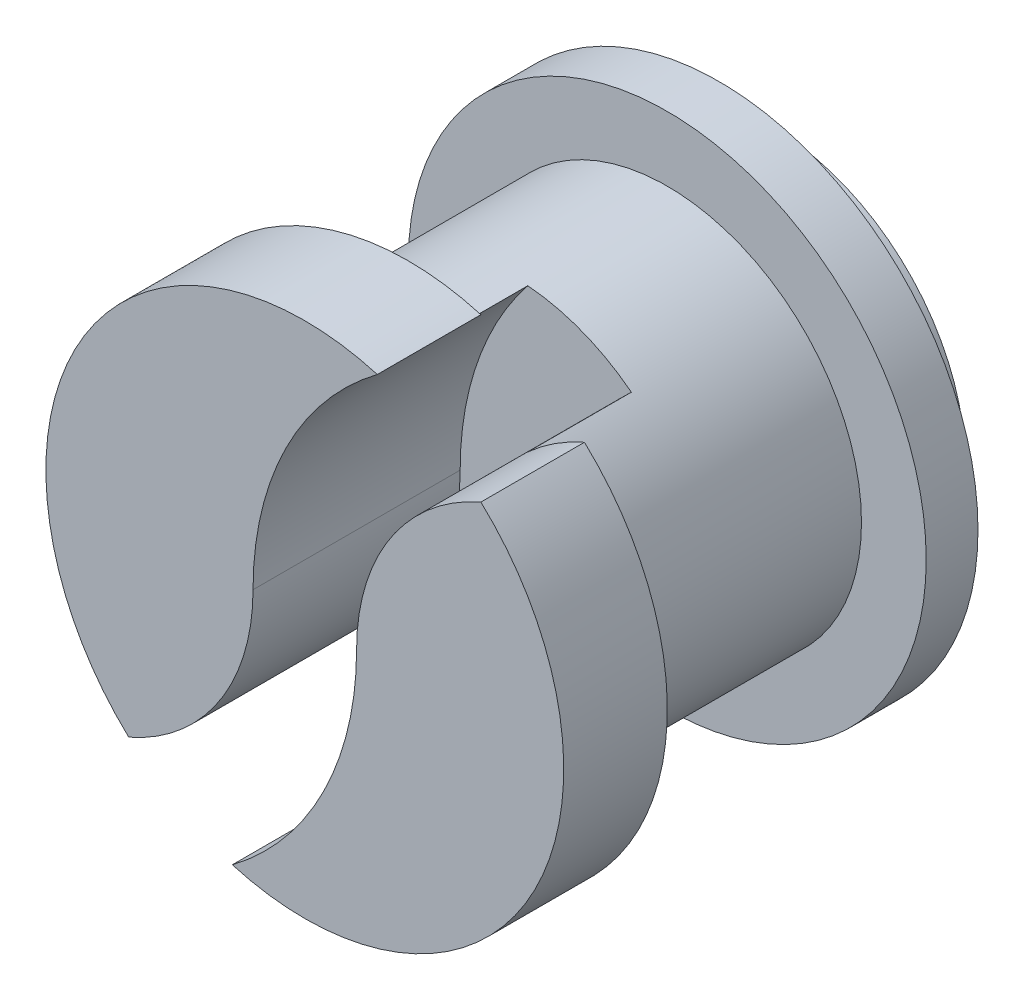
from build123d import *

# Parameters (mm, degrees)
SKETCH_1_R          = 7.5
EXTRUDE_1_DEPTH     = 16
EXTRUDE_START       = 2
SKETCH_2_R          = 10
EXTRUDE_2_DEPTH     = 2
EXTRUDE_START_2     = 14
SKETCH_5_R          = 10
EXTRUDE_3_DEPTH     = 4
CUT_EXTRUDE_START   = 10
CUT_EXTRUDE_3_DEPTH = 8
SKETCH_10_R         = 6.5
CUT_EXTRUDE_4_DEPTH = 3
SKETCH_11_W         = 10
SKETCH_11_H         = 5
CUT_EXTRUDE_5_DEPTH = 5


with BuildPart() as part:
    # Эскиз1 → Бобышка-Вытянуть1 (new body)
    with BuildSketch(Plane.XY):
        Circle(SKETCH_1_R)
    extrude(amount=EXTRUDE_1_DEPTH)

    # Эскиз2 → Бобышка-Вытянуть2 (add)
    with BuildSketch(Plane.XY.offset(EXTRUDE_START)):
        Circle(SKETCH_2_R)
    extrude(amount=EXTRUDE_2_DEPTH)

    # Эскиз5 → Бобышка-Вытянуть3 (add)
    with BuildSketch(Plane.XY.offset(EXTRUDE_START_2)):
        Circle(SKETCH_5_R)
    extrude(amount=EXTRUDE_3_DEPTH)

    # Эскиз9 → Вырез-Вытянуть3 (cut)
    with BuildSketch(Plane.XY.offset(CUT_EXTRUDE_START)):
        with BuildLine():
            ThreePointArc((2, 0), (5.550280908, 6.648308055), (13.05, 7.395775821))
            ThreePointArc((13.05, 7.395775821), (11.283433415, 9.883528235), (9.05, 11.962336728))
            ThreePointArc((9.05, 11.962336728), (1.185239652, 8.142481194), (-2, 0))
            ThreePointArc((-2, 0), (-5.550280908, -6.648308055), (-13.05, -7.395775821))
            ThreePointArc((-13.05, -7.395775821), (-11.283433415, -9.883528235), (-9.05, -11.962336728))
            ThreePointArc((-9.05, -11.962336728), (-1.185239652, -8.142481194), (2, 0))
        make_face()
    extrude(amount=CUT_EXTRUDE_3_DEPTH, mode=Mode.SUBTRACT)

    # Эскиз10 → Вырез-Вытянуть4 (cut)
    with BuildSketch(Plane.XY):
        Circle(SKETCH_10_R)
    extrude(amount=CUT_EXTRUDE_4_DEPTH, mode=Mode.SUBTRACT)

    # Эскиз11 → Вырез-Вытянуть5 (cut)
    with BuildSketch(Plane.XY):
        Rectangle(SKETCH_11_W, SKETCH_11_H)
    extrude(amount=CUT_EXTRUDE_5_DEPTH, mode=Mode.SUBTRACT)


solid = part.part
